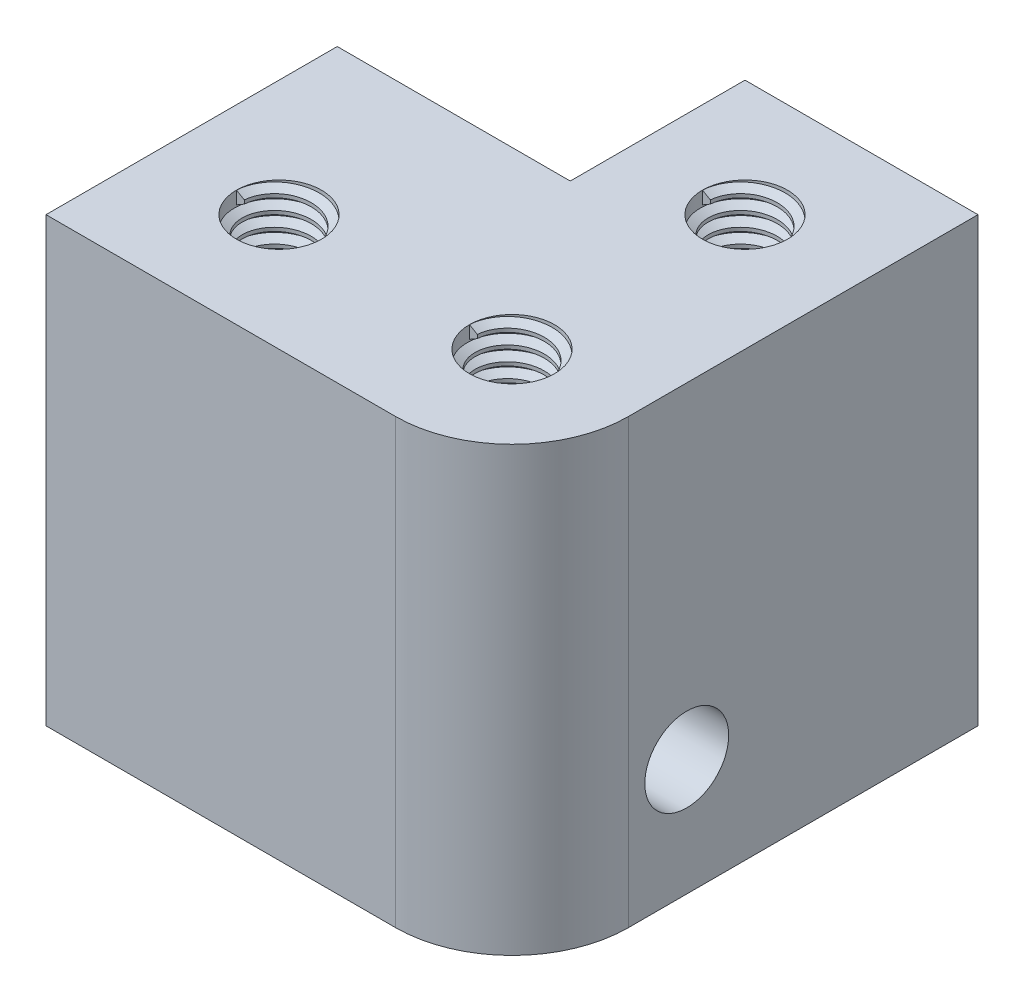
from build123d import *
from build123d.topology import SkipClean

# Parameters (mm, degrees)
BASE_EXTRUDE_DEPTH     = 24.13
SKETCH2_R              = 2.286
AXLE_CUT_DEPTH         = 44.273281595
SKETCH3_R              = 2.31775
MOUTING_HOLE_CUT_DEPTH = 12.7
FRONT_THREAD_PITCH     = 0.79375
MIDDLE_THREAD_PITCH    = 0.79375
SIDE_THREAD_PITCH      = 0.79375


with BuildPart() as part:
    # Sketch1 → Base Extrude (new body)
    with BuildSketch(Plane(origin=(0, 0, 0), x_dir=(1, 0, 0), z_dir=(0, 1, 0))):
        with BuildLine():
            Line((0, 15.875), (12.7, 15.875))
            Line((12.7, 15.875), (12.7, 25.4))
            Line((12.7, 25.4), (25.4, 25.4))
            Line((25.4, 25.4), (25.4, 6.35))
            ThreePointArc((25.4, 6.35), (23.540128061, 1.859871939), (19.05, 0))
            Line((19.05, 0), (0, 0))
            Line((0, 0), (0, 15.875))
        make_face()
    extrude(amount=BASE_EXTRUDE_DEPTH)

    # Sketch2 → Axle Cut (cut, through all)
    with BuildSketch(Plane(origin=(25.4, 0, 0), x_dir=(0, 0, -1), z_dir=(1, 0, 0))):
        with Locations((9.525, 6.35)):
            Circle(SKETCH2_R)
    extrude(amount=-AXLE_CUT_DEPTH, mode=Mode.SUBTRACT)

    # Sketch3 → Mouting Hole Cut (cut)
    with BuildSketch(Plane(origin=(0, 24.13, 0), x_dir=(1, 0, 0), z_dir=(0, 1, 0))):
        with Locations(Location((6.35, 6.35, 0), (0, 0, 270))):
            Circle(SKETCH3_R)
        with Locations(Location((19.05, 6.35, 0), (0, 0, 270))):
            Circle(SKETCH3_R)
        with Locations(Location((19.05, 19.05, 0), (0, 0, 270))):
            Circle(SKETCH3_R)
    extrude(amount=-MOUTING_HOLE_CUT_DEPTH, mode=Mode.SUBTRACT)

    # Front Thread: the profile of Thread Profile1 profile screwed along a right-hand helix of 16 turns, 8 arcs to a turn; built about Z, then put on its axis
    front_thread_z = Axis((0, 0, 0), (0, 0, 1))
    front_thread_corners = [(2.31805, 0, -0.000173205), (2.31805, 0, 0.694704453), (1.888120212, 0, 0.446484374), (1.888120212, 0, 0.248046874)]
    with BuildLine(mode=Mode.PRIVATE) as front_thread_profile:
        Line(front_thread_corners[0], front_thread_corners[1])
        Line(front_thread_corners[1], front_thread_corners[2])
        Line(front_thread_corners[2], front_thread_corners[3])
        Line(front_thread_corners[3], front_thread_corners[0])
    front_thread_cap = Face(front_thread_profile.wire())
    front_thread_turn_angles = [0, 22.5, 45, 67.5, 90, 112.5, 135, 157.5, 180, 202.5, 225, 247.5, 270, 292.5, 315, 337.5, 360]
    front_thread_turn_weights = [1, 0.9238795325112867, 1, 0.9238795325112867, 1, 0.9238795325112867, 1, 0.9238795325112867, 1, 0.9238795325112867, 1, 0.9238795325112867, 1, 0.9238795325112867, 1, 0.9238795325112867, 1]
    front_thread_turn_rails = [Edge.make_bspline([Vector(p[0], p[1], 0).rotate(front_thread_z, front_thread_turn_angles[k]) / front_thread_turn_weights[k] + Vector(0, 0, p[2] + FRONT_THREAD_PITCH * front_thread_turn_angles[k] / 360) for k in range(17)], [0, 0, 0, 1, 1, 2, 2, 3, 3, 4, 4, 5, 5, 6, 6, 7, 7, 8, 8, 8], 2, front_thread_turn_weights) for p in front_thread_corners]
    front_thread_turn_sides = [Face.make_surface_from_curves(front_thread_turn_rails[p[0]], front_thread_turn_rails[p[1]]) for p in [(0, 1), (1, 2), (2, 3), (3, 0)]]
    front_thread = Plane(origin=(6.35, 24.13, -6.35), x_dir=(-1, 0, 0), z_dir=(0, -1, 0)) * Solid(Shell([*[p.moved(Location((0, 0, FRONT_THREAD_PITCH * i))) for i in range(16) for p in front_thread_turn_sides], front_thread_cap, front_thread_cap.rotate(front_thread_z, 5760).moved(Location((0, 0, FRONT_THREAD_PITCH * 5760 / 360)))]))
    add(front_thread)

    # Middle Thread: the profile of Thread Profile2 profile screwed along a right-hand helix of 16 turns, 8 arcs to a turn; built about Z, then put on its axis
    with SkipClean():  # the faces are left unmerged after this step: merging them gives an invalid solid
        middle_thread_z = Axis((0, 0, 0), (0, 0, 1))
        middle_thread_corners = [(2.31805, 0, -0.000173205), (2.31805, 0, 0.694704453), (1.888120212, 0, 0.446484374), (1.888120212, 0, 0.248046874)]
        with BuildLine(mode=Mode.PRIVATE) as middle_thread_profile:
            Line(middle_thread_corners[0], middle_thread_corners[1])
            Line(middle_thread_corners[1], middle_thread_corners[2])
            Line(middle_thread_corners[2], middle_thread_corners[3])
            Line(middle_thread_corners[3], middle_thread_corners[0])
        middle_thread_cap = Face(middle_thread_profile.wire())
        middle_thread_turn_angles = [0, 22.5, 45, 67.5, 90, 112.5, 135, 157.5, 180, 202.5, 225, 247.5, 270, 292.5, 315, 337.5, 360]
        middle_thread_turn_weights = [1, 0.9238795325112867, 1, 0.9238795325112867, 1, 0.9238795325112867, 1, 0.9238795325112867, 1, 0.9238795325112867, 1, 0.9238795325112867, 1, 0.9238795325112867, 1, 0.9238795325112867, 1]
        middle_thread_turn_rails = [Edge.make_bspline([Vector(p[0], p[1], 0).rotate(middle_thread_z, middle_thread_turn_angles[k]) / middle_thread_turn_weights[k] + Vector(0, 0, p[2] + MIDDLE_THREAD_PITCH * middle_thread_turn_angles[k] / 360) for k in range(17)], [0, 0, 0, 1, 1, 2, 2, 3, 3, 4, 4, 5, 5, 6, 6, 7, 7, 8, 8, 8], 2, middle_thread_turn_weights) for p in middle_thread_corners]
        middle_thread_turn_sides = [Face.make_surface_from_curves(middle_thread_turn_rails[p[0]], middle_thread_turn_rails[p[1]]) for p in [(0, 1), (1, 2), (2, 3), (3, 0)]]
        middle_thread = Plane(origin=(19.05, 24.13, -6.35), x_dir=(-1, 0, 0), z_dir=(0, -1, 0)) * Solid(Shell([*[p.moved(Location((0, 0, MIDDLE_THREAD_PITCH * i))) for i in range(16) for p in middle_thread_turn_sides], middle_thread_cap, middle_thread_cap.rotate(middle_thread_z, 5760).moved(Location((0, 0, MIDDLE_THREAD_PITCH * 5760 / 360)))]))
        add(middle_thread)

    # Side Thread: the profile of Thread Profile3 profile screwed along a right-hand helix of 16 turns, 8 arcs to a turn; built about Z, then put on its axis
    with SkipClean():  # the faces are left unmerged after this step: merging them gives an invalid solid
        side_thread_z = Axis((0, 0, 0), (0, 0, 1))
        side_thread_corners = [(2.31805, 0, -0.000173205), (2.31805, 0, 0.694704453), (1.888120212, 0, 0.446484374), (1.888120212, 0, 0.248046874)]
        with BuildLine(mode=Mode.PRIVATE) as side_thread_profile:
            Line(side_thread_corners[0], side_thread_corners[1])
            Line(side_thread_corners[1], side_thread_corners[2])
            Line(side_thread_corners[2], side_thread_corners[3])
            Line(side_thread_corners[3], side_thread_corners[0])
        side_thread_cap = Face(side_thread_profile.wire())
        side_thread_turn_angles = [0, 22.5, 45, 67.5, 90, 112.5, 135, 157.5, 180, 202.5, 225, 247.5, 270, 292.5, 315, 337.5, 360]
        side_thread_turn_weights = [1, 0.9238795325112867, 1, 0.9238795325112867, 1, 0.9238795325112867, 1, 0.9238795325112867, 1, 0.9238795325112867, 1, 0.9238795325112867, 1, 0.9238795325112867, 1, 0.9238795325112867, 1]
        side_thread_turn_rails = [Edge.make_bspline([Vector(p[0], p[1], 0).rotate(side_thread_z, side_thread_turn_angles[k]) / side_thread_turn_weights[k] + Vector(0, 0, p[2] + SIDE_THREAD_PITCH * side_thread_turn_angles[k] / 360) for k in range(17)], [0, 0, 0, 1, 1, 2, 2, 3, 3, 4, 4, 5, 5, 6, 6, 7, 7, 8, 8, 8], 2, side_thread_turn_weights) for p in side_thread_corners]
        side_thread_turn_sides = [Face.make_surface_from_curves(side_thread_turn_rails[p[0]], side_thread_turn_rails[p[1]]) for p in [(0, 1), (1, 2), (2, 3), (3, 0)]]
        side_thread = Plane(origin=(19.05, 24.13, -19.05), x_dir=(-1, 0, 0), z_dir=(0, -1, 0)) * Solid(Shell([*[p.moved(Location((0, 0, SIDE_THREAD_PITCH * i))) for i in range(16) for p in side_thread_turn_sides], side_thread_cap, side_thread_cap.rotate(side_thread_z, 5760).moved(Location((0, 0, SIDE_THREAD_PITCH * 5760 / 360)))]))
        add(side_thread)


solid = part.part
